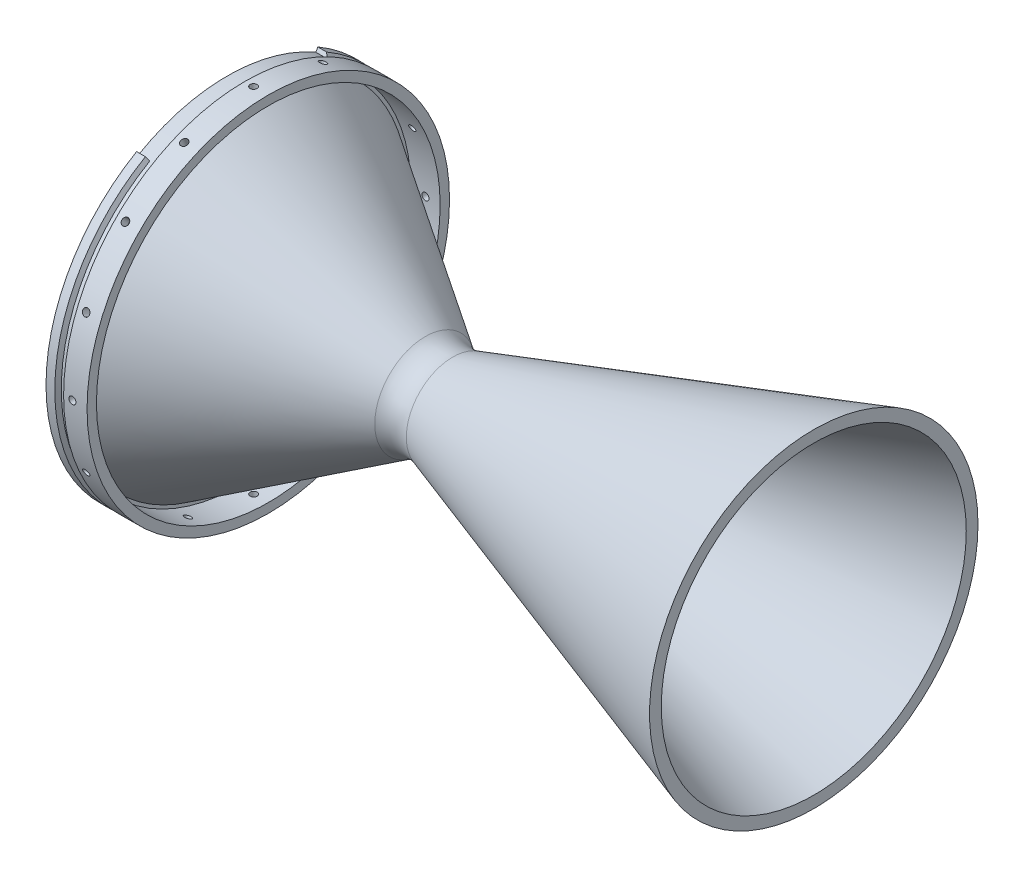
from build123d import *

# Parameters (mm, degrees)
BOLT_BORE_D_60MM_REACH       = 4266.402
BOLT_BORE_D_60MM_END_RADIUS  = 1465
SKETCH2_R                    = 30
BOLT_BORE_PATTERN_N_16_COUNT = 16
DOVETAIL_START               = -95.207259522
DOVETAIL_CUT_SLOTS_DEPTH     = 95.207259522


# Read off the part's stored shape, not the designer's step: Dovetail Cut Slots
with BuildPart() as part:
    # Sketch1 → C-D Nozzle Revolve (revolve)
    with BuildSketch(Plane.XY, mode=Mode.PRIVATE) as c_d_nozzle_revolve_sk:
        with BuildLine():
            Line((-532.599018038, 253.072772508), (2500, 1300))
            Line((2500, 1300), (2500, 1400))
            Line((2500, 1400), (-577.407598198, 396.33154827))
            ThreePointArc((-577.407598198, 396.33154827), (-699.059802851, 383.771164063), (-812.113413644, 430.417742016))
            Line((-812.113413644, 430.417742016), (-2400, 1437.589055626))
            Line((-2400, 1437.589055626), (-2400, 1465))
            Line((-2400, 1465), (-2150, 1465))
            Line((-2150, 1465), (-2150, 1545))
            Line((-2150, 1545), (-2350, 1545))
            Line((-2350, 1545), (-2370.207259422, 1510))
            Line((-2370.207259422, 1510), (-2404.792740578, 1510))
            Line((-2404.792740578, 1510), (-2425, 1545))
            Line((-2425, 1545), (-2500, 1545))
            Line((-2500, 1545), (-2500, 1400))
            Line((-2500, 1400), (-888.539800524, 300.736382969))
            ThreePointArc((-888.539800524, 300.736382969), (-716.219033695, 234.714493621), (-532.599018038, 253.072772508))
        make_face()
    revolve(c_d_nozzle_revolve_sk.sketch.rotate(Axis((2912.663755459, 0, 0), (-1, 0, 0)), 90), axis=Axis((2912.663755459, 0, 0), (-1, 0, 0)))

    # Bolt Bore D = 60mm: up to this cylinder (the profile starts outside it)
    bolt_bore_d_60mm_end = Plane(origin=(-2275, 0, 0), z_dir=(1, 0, 0)) * Cylinder(BOLT_BORE_D_60MM_END_RADIUS, 11463.804, mode=Mode.PRIVATE)
    # Sketch2 → Bolt Bore D = 60mm (cut, up to the surface)
    with BuildSketch(Plane.XY.offset(1545), mode=Mode.PRIVATE) as bolt_bore_d_60mm_sk1:
        with Locations((-2275, 0)):
            Circle(SKETCH2_R)
    bolt_bore_d_60mm_tool1 = extrude(bolt_bore_d_60mm_sk1.sketch, amount=-BOLT_BORE_D_60MM_REACH, mode=Mode.PRIVATE) - bolt_bore_d_60mm_end
    bolt_bore_d_60mm = bolt_bore_d_60mm_tool1.solids().sort_by_distance((-2275, 0, 1545))[0]
    add(bolt_bore_d_60mm, mode=Mode.SUBTRACT)

    # Bolt Bore Pattern n = 16: Bolt Bore D = 60mm ×16 about axis
    bolt_bore_pattern_n_16_axis = Axis((-2500, 0, 0), (1, 0, 0))
    for i in range(1, BOLT_BORE_PATTERN_N_16_COUNT):
        add(bolt_bore_d_60mm.rotate(bolt_bore_pattern_n_16_axis, i * 360 / BOLT_BORE_PATTERN_N_16_COUNT), mode=Mode.SUBTRACT)

    # Dovetail Cut Slots outline → Dovetail Cut Slots (cut)
    with BuildSketch(Plane.ZY.offset(2500).offset(DOVETAIL_START)):
        with BuildLine():
            ThreePointArc((-755, 1307.698359714), (0, 1510), (755, 1307.698359714))
            Line((755, 1307.698359714), (772.5, 1338.009248847))
            ThreePointArc((772.5, 1338.009248847), (0, 1545), (-772.5, 1338.009248847))
            Line((-772.5, 1338.009248847), (-755, 1307.698359714))
        make_face()
        with BuildLine():
            Line((772.5, -1338.009248847), (755, -1307.698359714))
            ThreePointArc((755, -1307.698359714), (0, -1510), (-755, -1307.698359714))
            Line((-755, -1307.698359714), (-772.5, -1338.009248847))
            ThreePointArc((-772.5, -1338.009248847), (0, -1545), (772.5, -1338.009248847))
        make_face()
    extrude(amount=DOVETAIL_CUT_SLOTS_DEPTH, mode=Mode.SUBTRACT)


solid = part.part
